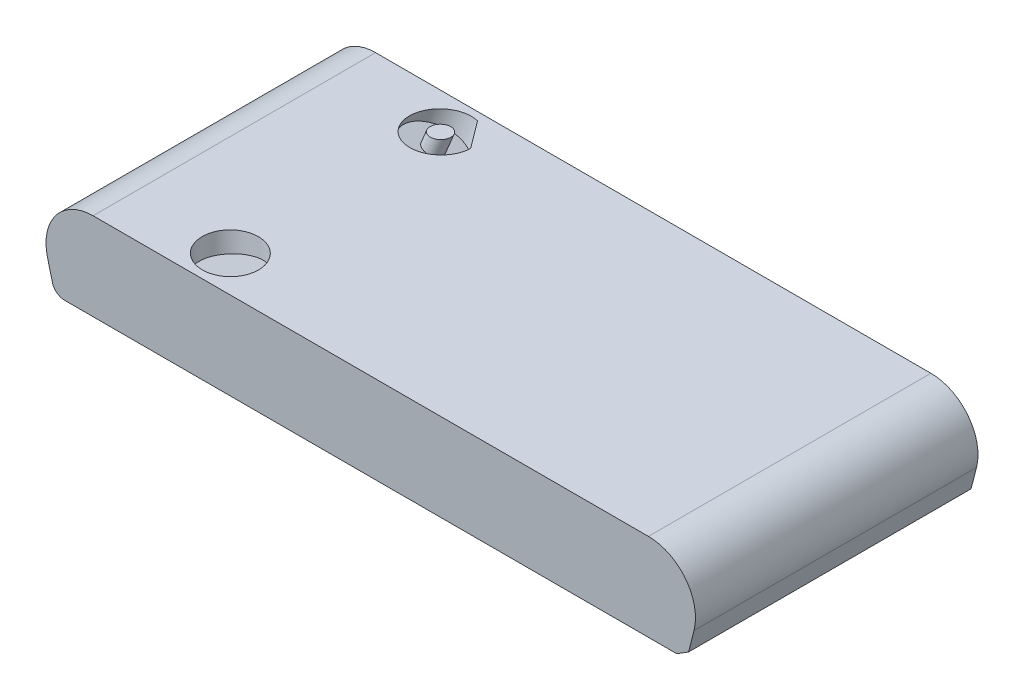
from build123d import *

# Parameters (mm, degrees)
BODY_GLIDER_RIGHT_DEPTH      = 30
BODY_GLIDER_RIGHT_DEPTH_BACK = 30


with BuildPart() as part:
    # Sketch9 → Body_Glider_Right (new, two sides: drawn at the far end of the back side and taken through both)
    with BuildSketch(Plane.XY.offset(-BODY_GLIDER_RIGHT_DEPTH_BACK)):
        with BuildLine():
            Line((0, 0), (-1.159340651, 4.516056966))
            ThreePointArc((-1.159340651, 4.516056966), (0.625154988, 13.13180513), (8.52658689, 17.002582186))
            Line((8.52658689, 17.002582186), (126.46665294, 17.002582186))
            ThreePointArc((126.46665294, 17.002582186), (134.368084842, 13.13180513), (136.152580481, 4.516056966))
            Line((136.152580481, 4.516056966), (134.99323983, 0))
            Line((134.99323983, 0), (132.496619915, -1.571345027))
            Line((132.496619915, -1.571345027), (2.496619915, -1.571345027))
            ThreePointArc((2.496619915, -1.571345027), (1.021642272, -1.145811788), (0, 0))
        make_face()
    extrude(amount=BODY_GLIDER_RIGHT_DEPTH + BODY_GLIDER_RIGHT_DEPTH_BACK)

    # Sketch6 → BallBearingHoleRW (revolve, cut)
    with BuildSketch(Plane(origin=(0, 0, 0), x_dir=(0.8022929282893954, 0, -0.5969305296404492), z_dir=(0.5969305296404492, 0, 0.8022929282893954))):
        Polygon((43.279952192, 15.634501613), (41.911871619, 11.87573113), (38.153101135, 13.243811703), (39.521181709, 17.002582186), (39.867435892, 17.953907737), (43.626206376, 16.585827164), align=None)
    revolve(axis=Axis((30, 17.002582186, -22.320919527), (0.27440034232271016, 0.9396926207859081, -0.20416226530309425)), mode=Mode.SUBTRACT)

    # Sketch8 → BallBearingHoleLW (revolve, cut)
    with BuildSketch(Plane(origin=(0, 0, 0), x_dir=(0.8022929282893954, 0, 0.5969305296404492), z_dir=(-0.5969305296404492, 0, 0.8022929282893954))):
        Polygon((31.300266493, 17.002582186), (37.209113011, 18.044471252), (37.903705721, 14.10524024), (31.994859203, 13.063351174), align=None)
    revolve(axis=Axis((30, 17.002582186, 22.320919527), (-0.13931670495251347, 0.9848077530122092, -0.10365589866581565)), mode=Mode.SUBTRACT)


solid = part.part
